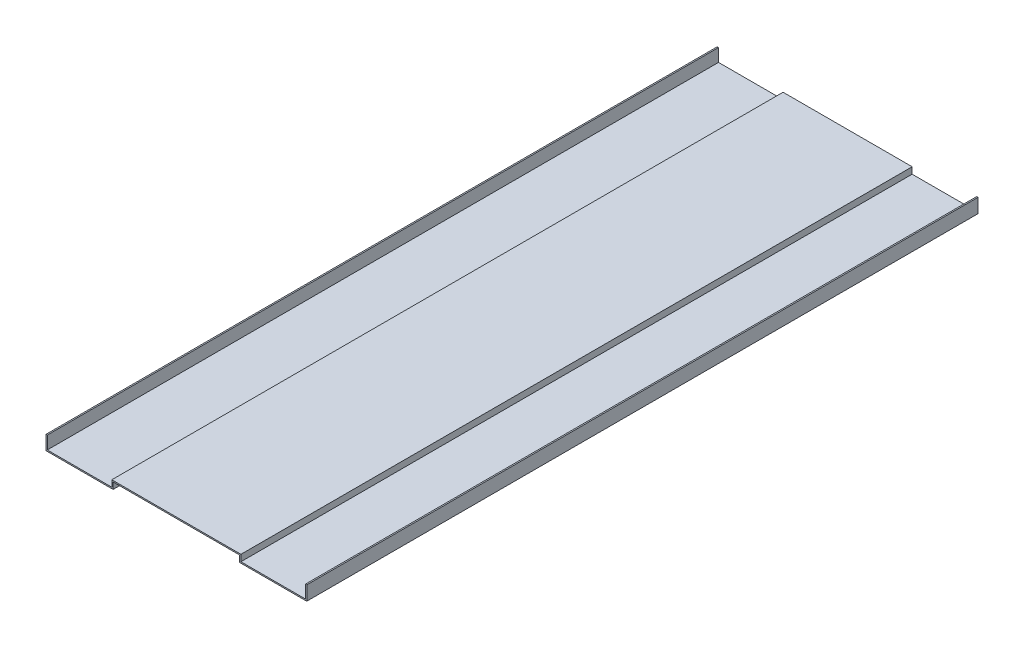
from build123d import *

# Parameters (mm, degrees)
BOSS_EXTRUDE1_DEPTH = 5200
RIB1_REACH          = 5507.482
SKETCH2_WALLS_W     = 11992.963229826
SKETCH2_WALLS_H     = 10
SKETCH3_W           = 70
SKETCH3_H           = 5
BOSS_EXTRUDE2_DEPTH = 35
SKETCH4_W           = 70
SKETCH4_H           = 5
BOSS_EXTRUDE3_DEPTH = 35
SKETCH6_W           = 60
SKETCH6_H           = 20
BOSS_EXTRUDE5_DEPTH = 2000
SKETCH7_W           = 10
SKETCH7_H           = 39.988397119
SKETCH7_W_2         = 9.978776679
SKETCH7_H_2         = 40
CUT_EXTRUDE1_DEPTH  = 5518.420337809
SKETCH8_W           = 10.659440655
SKETCH8_H           = 50.244619817
SKETCH8_W_2         = 36.147201271
SKETCH8_H_2         = 63.106865185
CUT_EXTRUDE2_DEPTH  = 5518.420337809
SKETCH9_W           = 81.57273963
SKETCH9_H           = 67.362460328
SKETCH9_W_2         = 80.643055667
SKETCH9_H_2         = 59.078828037
CUT_EXTRUDE3_DEPTH  = 5518.420337809
SPLIT1_START        = 106.966292135
SPLIT1_OUTLINE_W    = 2000
SPLIT1_OUTLINE_H    = 60
SPLIT1_DEPTH        = 20


# Read off the part's stored shape, not the designer's step: Split1
with BuildPart() as part:
    # Sketch1 → Boss-Extrude1 (new body)
    with BuildSketch(Plane.XY):
        Polygon((-294.943820225, 76.966292135), (-294.943820225, 126.966292135), (-244.943820225, 126.966292135), (-244.943820225, 26.966292135), (255.056179775, 26.966292135), (255.056179775, 76.966292135), (1255.056179775, 76.966292135), (1255.056179775, 26.966292135), (1755.056179775, 26.966292135), (1755.056179775, 126.966292135), (1805.056179775, 126.966292135), (1805.056179775, 76.966292135), (1795.056179775, 76.966292135), (1795.056179775, 116.966292135), (1765.056179775, 116.966292135), (1765.056179775, 16.966292135), (1245.056179775, 16.966292135), (1245.056179775, 66.966292135), (265.056179775, 66.966292135), (265.056179775, 16.966292135), (-254.943820225, 16.966292135), (-254.943820225, 116.966292135), (-284.943820225, 116.966292135), (-284.943820225, 76.966292135), align=None)
    extrude(amount=BOSS_EXTRUDE1_DEPTH)

    # Sketch2 walls → Rib1 (add, up to next)
    with BuildSketch(Plane.XZ.offset(-16.966292135), mode=Mode.PRIVATE) as rib1_sk1:
        with Locations((755.056179775, 1500)):
            Rectangle(SKETCH2_WALLS_W, SKETCH2_WALLS_H)
    rib1_tool1 = extrude(rib1_sk1.sketch, amount=-RIB1_REACH, mode=Mode.PRIVATE) - part.part
    # Sketch2 walls → Rib1 (add, up to next)
    with BuildSketch(Plane.XZ.offset(-16.966292135), mode=Mode.PRIVATE) as rib1_sk2:
        with Locations((755.056179775, 3500)):
            Rectangle(SKETCH2_WALLS_W, SKETCH2_WALLS_H)
    rib1_tool2 = extrude(rib1_sk2.sketch, amount=-RIB1_REACH, mode=Mode.PRIVATE) - part.part
    add(rib1_tool1.solids().sort_by_distance((755.056179775, 16.966292135, 1500))[0])
    add(rib1_tool2.solids().sort_by_distance((755.056179775, 16.966292135, 3500))[0])

    # Sketch3 → Boss-Extrude2 (add)
    with BuildSketch(Plane(origin=(1805.056179775, 0, 0), x_dir=(0, 0, -1), z_dir=(1, 0, 0))):
        with Locations((-35, 124.466292135)):
            Rectangle(SKETCH3_W, SKETCH3_H)
        with Locations((-5165, 124.466292135)):
            Rectangle(SKETCH3_W, SKETCH3_H)
    extrude(amount=BOSS_EXTRUDE2_DEPTH)

    # Sketch4 → Boss-Extrude3 (add)
    with BuildSketch(Plane.ZY.offset(294.943820225)):
        with Locations((35, 124.466292135)):
            Rectangle(SKETCH4_W, SKETCH4_H)
        with Locations((5165, 124.466292135)):
            Rectangle(SKETCH4_W, SKETCH4_H)
    extrude(amount=BOSS_EXTRUDE3_DEPTH)

    # Sketch6 → Boss-Extrude5 (add)
    with BuildSketch(Plane(origin=(-244.943820225, 0, 0), x_dir=(0, 0, -1), z_dir=(1, 0, 0))):
        with Locations((-5170, 116.966292135)):
            Rectangle(SKETCH6_W, SKETCH6_H)
    extrude(amount=BOSS_EXTRUDE5_DEPTH)

    # Sketch7 → Cut-Extrude1 (cut, through all)
    with BuildSketch(Plane.XY.offset(5200)):
        with Locations((-289.943820225, 96.972093575)):
            Rectangle(SKETCH7_W, SKETCH7_H)
        with Locations((1800.045568115, 96.966292135)):
            Rectangle(SKETCH7_W_2, SKETCH7_H_2)
    extrude(amount=-CUT_EXTRUDE1_DEPTH, mode=Mode.SUBTRACT)


with BuildPart() as cut_extrude1_piece_1:
    # of the separate pieces the step leaves, piece 1, a body of its own (cut_extrude1_pieces)
    add(part.part.solids().sort_by_distance((-294.943820225, 116.966292135, 0))[0])


with BuildPart() as cut_extrude1_piece_2:
    # of the separate pieces the step leaves, piece 2, a body of its own (cut_extrude1_pieces)
    add(part.part.solids().sort_by_distance((-294.943820225, 76.966292135, 0))[0])


with BuildPart() as cut_extrude2_tool:
    # Sketch8 → Cut-Extrude2 (new, through all)
    with BuildSketch(Plane.XY.offset(5200)):
        with Locations((1805.361416771, 91.843982227)):
            Rectangle(SKETCH8_W, SKETCH8_H)
        with Locations((-291.630819883, 60.290549635)):
            Rectangle(SKETCH8_W_2, SKETCH8_H_2)
    extrude(amount=-CUT_EXTRUDE2_DEPTH)


with BuildPart() as cut_extrude1_piece_1_1:
    add(cut_extrude1_piece_1.part)

    # Cut-Extrude2: cut by cut_extrude2_tool
    add(cut_extrude2_tool.part, mode=Mode.SUBTRACT)

    # Sketch9 → Cut-Extrude3 (cut, through all)
    with BuildSketch(Plane(origin=(0, 0, 0), x_dir=(-1, 0, 0), z_dir=(0, 0, -1))):
        with Locations((295.73019004, 130.148013634)):
            Rectangle(SKETCH9_W, SKETCH9_H)
        with Locations((-1805.377707609, 122.845657173)):
            Rectangle(SKETCH9_W_2, SKETCH9_H_2)
    extrude(amount=-CUT_EXTRUDE3_DEPTH, mode=Mode.SUBTRACT)

    # Split1 outline → Split1 (cut)
    with BuildSketch(Plane(origin=(0, 0, 0), x_dir=(1, 0, 0), z_dir=(0, 1, 0)).offset(SPLIT1_START)):
        with Locations((755.056179775, -5170)):
            Rectangle(SPLIT1_OUTLINE_W, SPLIT1_OUTLINE_H)
    extrude(amount=SPLIT1_DEPTH, mode=Mode.SUBTRACT)


with BuildPart() as cut_extrude1_piece_2_1:
    add(cut_extrude1_piece_2.part)

    # Cut-Extrude2: cut by cut_extrude2_tool
    add(cut_extrude2_tool.part, mode=Mode.SUBTRACT)


solid = cut_extrude1_piece_1_1.part
